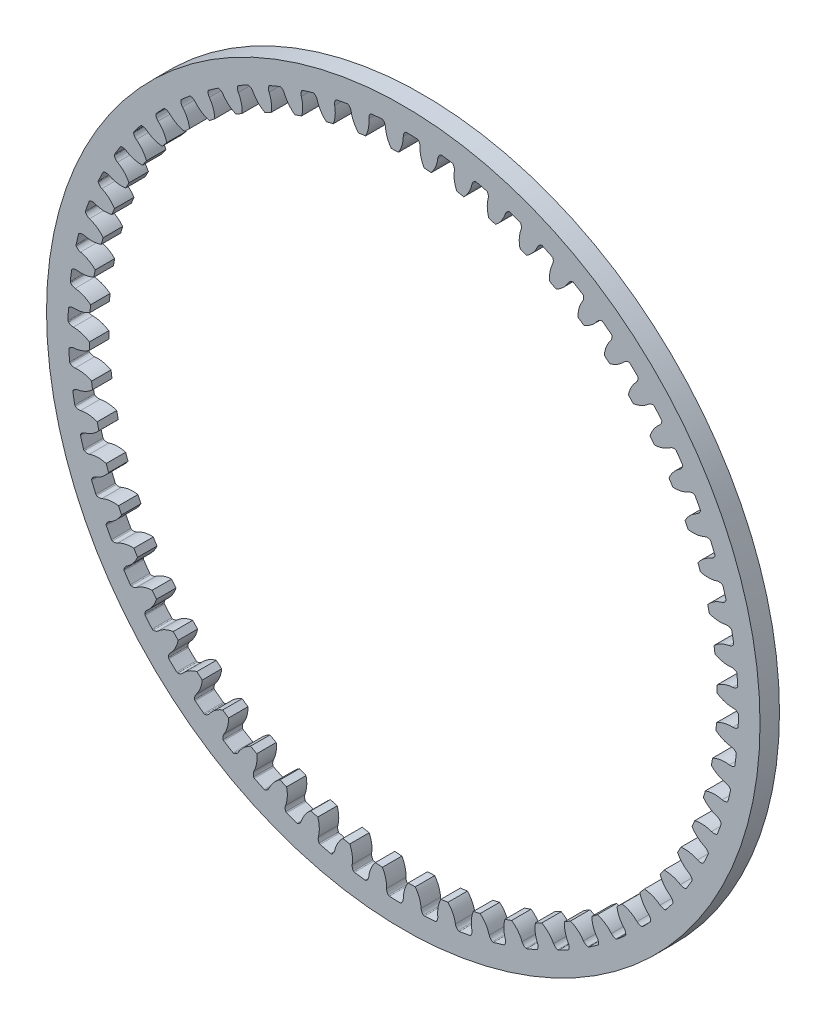
from build123d import *

# Parameters (mm, degrees)
BOSS_EXTRUDE1_DEPTH = 4
CHAMFER1_SIZE       = 0.5
FILLET2_R           = 1.4
FILLET3_R           = 0.3
CIRPATTERN1_DEPTH   = 4


# Read off the part's stored shape, not the designer's step: CirPattern1
with BuildPart() as part:
    # Sketch1 → Boss-Extrude1 (new body)
    with BuildSketch(Plane.XY):
        with BuildLine():
            Line((-7.093200614, 67.487306793), (-7.203054967, 68.532503961))
            ThreePointArc((-7.203054967, 68.532503961), (-5.465102965, 68.692945414), (-3.7236451, 68.809320351))
            Line((-3.7236451, 68.809320351), (-3.669087823, 67.801148418))
            ThreePointArc((-3.669087823, 67.801148418), (-3.311888955, 66.061957245), (-2.461340021, 64.503450435))
            Line((-2.461340021, 64.503450435), (-0.999634675, 64.542971937))
            ThreePointArc((-0.999634675, 64.542971937), (-0.255341962, 66.127311516), (0, 67.859045914))
            Line((0, 67.859045914), (0, 68.91))
            ThreePointArc((0, 68.91), (0.866615162, 68.90455049), (1.733093257, 68.88820282))
            Line((1.733093257, 68.88820282), (1.844759693, 73.326798387))
            ThreePointArc((1.844759693, 73.326798387), (-5.830083646, 73.117936409), (-13.441051368, 72.107979018))
            Line((-13.441051368, 72.107979018), (-12.627441714, 67.743160657))
            ThreePointArc((-12.627441714, 67.743160657), (-11.762567505, 67.898675287), (-10.895780524, 68.043148566))
            Line((-10.895780524, 68.043148566), (-10.736139102, 67.046202549))
            ThreePointArc((-10.736139102, 67.046202549), (-10.199101212, 65.353876174), (-9.190302449, 63.892813782))
            Line((-9.190302449, 63.892813782), (-7.740736018, 64.084908534))
            ThreePointArc((-7.740736018, 64.084908534), (-7.166128741, 65.738368542), (-7.093200614, 67.487306793))
        make_face()
    extrude(amount=BOSS_EXTRUDE1_DEPTH)

    # Chamfer1
    chamfer1_edges = [part.edges().sort_by_distance(p)[0] for p in [
        (-3.7236451, 68.809320351, 2),
        (-7.203054967, 68.532503961, 2),
        (-10.895780524, 68.043148566, 2),
        (0, 68.91, 2),
    ]]
    chamfer(chamfer1_edges, length=CHAMFER1_SIZE - 0.0004)  # a hair under: the kernel refuses the full size

    # Fillet2
    fillet2_edges = [part.edges().sort_by_distance(p)[0] for p in [
        (0, 68.4104, 2),
        (-3.696648719, 68.310450272, 2),
        (-7.150832686, 68.035640807, 2),
        (-10.81678572, 67.54983327, 2),
    ]]
    fillet(fillet2_edges, radius=FILLET2_R)

    # Fillet3
    fillet3_edges = [part.edges().sort_by_distance(p)[0] for p in [
        (-11.38880622, 67.962366004, 2),
        (0.499596717, 68.908188941, 2),
        (-4.222414028, 68.780515553, 2),
        (-6.706005784, 68.58292489, 2),
    ]]
    fillet(fillet3_edges, radius=FILLET3_R)

    # CirPattern1 outline → CirPattern1 (add)
    with BuildSketch(Plane.XY):
        with BuildLine():
            Line((1.844759693, 73.326798387), (1.733093257, 68.88820282))
            ThreePointArc((1.733093257, 68.88820282), (2.299511856, 68.871622205), (2.86577496, 68.850384413))
            ThreePointArc((2.86577496, 68.850384413), (2.980831386, 68.822186651), (3.076002513, 68.751649061))
            ThreePointArc((3.076002513, 68.751649061), (3.353485369, 68.289151249), (3.435535192, 67.756076407))
            ThreePointArc((3.435535192, 67.756076407), (3.618653485, 66.018512763), (4.294590654, 64.407373827))
            Line((4.294590654, 64.407373827), (5.752419325, 64.29388904))
            ThreePointArc((5.752419325, 64.29388904), (6.65368157, 65.780913241), (7.090699115, 67.463925503))
            ThreePointArc((7.090699115, 67.463925503), (7.25312204, 67.982028039), (7.600452429, 68.399368483))
            ThreePointArc((7.600452429, 68.399368483), (7.705424882, 68.454381137), (7.823510636, 68.464449033))
            ThreePointArc((7.823510636, 68.464449033), (8.936389306, 68.328098511), (10.046902252, 68.17365954))
            ThreePointArc((10.046902252, 68.17365954), (10.158380982, 68.133589535), (10.245657588, 68.05349018))
            ThreePointArc((10.245657588, 68.05349018), (10.4732759, 67.564521093), (10.499154515, 67.025790028))
            ThreePointArc((10.499154515, 67.025790028), (10.499644069, 65.278604195), (11.003467608, 63.605636647))
            Line((11.003467608, 63.605636647), (12.441448167, 63.34038888))
            ThreePointArc((12.441448167, 63.34038888), (13.493209118, 64.725059646), (14.103754874, 66.353171468))
            ThreePointArc((14.103754874, 66.353171468), (14.319444274, 66.851457878), (14.708495626, 67.230206223))
            ThreePointArc((14.708495626, 67.230206223), (14.818643464, 67.273944969), (14.937134782, 67.271614404))
            ThreePointArc((14.937134782, 67.271614404), (16.029664521, 67.019683343), (17.117950738, 66.750010206))
            ThreePointArc((17.117950738, 66.750010206), (17.224630261, 66.698507056), (17.30305608, 66.609723692))
            ThreePointArc((17.30305608, 66.609723692), (17.478316569, 66.099640638), (17.447740914, 65.561155642))
            ThreePointArc((17.447740914, 65.561155642), (17.265597838, 63.823489498), (17.591789537, 62.107022574))
            Line((17.591789537, 62.107022574), (18.994166341, 61.692918078))
            ThreePointArc((18.994166341, 61.692918078), (20.184903559, 62.960064275), (20.962289148, 64.515437624))
            ThreePointArc((20.962289148, 64.515437624), (21.228882316, 64.988448752), (21.65539266, 65.324455258))
            ThreePointArc((21.65539266, 65.324455258), (21.769508987, 65.356440753), (21.887107517, 65.341737232))
            ThreePointArc((21.887107517, 65.341737232), (22.947318251, 64.976985811), (24.001454157, 64.595033078))
            ThreePointArc((24.001454157, 64.595033078), (24.102165787, 64.532660967), (24.170881597, 64.436166149))
            ThreePointArc((24.170881597, 64.436166149), (24.291863513, 63.910557702), (24.205168131, 63.378218736))
            ThreePointArc((24.205168131, 63.378218736), (23.842386627, 61.669111322), (23.987370901, 59.927951325))
            Line((23.987370901, 59.927951325), (25.338780023, 59.369526888))
            ThreePointArc((25.338780023, 59.369526888), (26.655446714, 60.505265877), (27.591154063, 61.97085995))
            ThreePointArc((27.591154063, 61.97085995), (27.905729702, 62.413413258), (28.365025556, 62.702996719))
            ThreePointArc((28.365025556, 62.702996719), (28.481860196, 62.722878645), (28.597277643, 62.695963278))
            ThreePointArc((28.597277643, 62.695963278), (29.613553574, 62.22238781), (30.621989928, 61.732340251))
            ThreePointArc((30.621989928, 61.732340251), (30.71563014, 61.659782649), (30.773883068, 61.556633769))
            ThreePointArc((30.773883068, 61.556633769), (30.839261464, 61.021258549), (30.697396635, 60.500897778))
            ThreePointArc((30.697396635, 60.500897778), (30.157952716, 58.839073484), (30.120142804, 57.092296412))
            Line((30.120142804, 57.092296412), (31.405777144, 56.395670561))
            ThreePointArc((31.405777144, 56.395670561), (32.833948405, 57.387558385), (33.917726556, 58.747315543))
            ThreePointArc((33.917726556, 58.747315543), (34.276838568, 59.154562406), (34.763888318, 59.394549876))
            ThreePointArc((34.763888318, 59.394549876), (34.882161088, 59.402110294), (34.994132774, 59.36327797))
            ThreePointArc((34.994132774, 59.36327797), (35.955339275, 58.786067037), (36.907027344, 58.193293709))
            ThreePointArc((36.907027344, 58.193293709), (36.992570292, 58.111345453), (37.039722096, 58.002672457))
            ThreePointArc((37.039722096, 58.002672457), (37.048780125, 57.463396261), (36.853299751, 56.960715162))
            ThreePointArc((36.853299751, 56.960715162), (36.143102481, 55.364382361), (35.922910982, 53.631126963))
            Line((35.922910982, 53.631126963), (37.128685603, 52.803931684))
            ThreePointArc((37.128685603, 52.803931684), (38.652713382, 53.641101654), (39.872687422, 54.880124483))
            ThreePointArc((39.872687422, 54.880124483), (40.272400835, 55.247602986), (40.78186776, 55.435365376))
            ThreePointArc((40.78186776, 55.435365376), (40.900282967, 55.430521547), (41.007582247, 55.380197709))
            ThreePointArc((41.007582247, 55.380197709), (41.903188234, 54.705675353), (42.787701218, 54.016670802))
            ThreePointArc((42.787701218, 54.016670802), (42.864209593, 53.926229863), (42.899743696, 53.813223569))
            ThreePointArc((42.899743696, 53.813223569), (42.85238265, 53.275954649), (42.60542882, 52.796460366))
            ThreePointArc((42.60542882, 52.796460366), (41.732260347, 51.283107617), (41.332101297, 49.582362938))
            Line((41.332101297, 49.582362938), (42.444804783, 48.633661623))
            ThreePointArc((42.444804783, 48.633661623), (44.047992151, 49.306940817), (45.390796558, 50.411653871))
            ThreePointArc((45.390796558, 50.411653871), (45.826732496, 50.735337827), (46.353035241, 50.868817659))
            ThreePointArc((46.353035241, 50.868817659), (46.470295365, 50.851622571), (46.571746508, 50.790358605))
            ThreePointArc((46.571746508, 50.790358605), (47.391939439, 50.025915046), (48.199586335, 49.248228162))
            ThreePointArc((48.199586335, 49.248228162), (48.266221965, 49.150285293), (48.289749003, 49.034183652))
            ThreePointArc((48.289749003, 49.034183652), (48.186487266, 48.504808664), (47.890765331, 48.053755008))
            ThreePointArc((47.890765331, 48.053755008), (46.864191322, 46.639964225), (46.288447476, 44.990365002))
            Line((46.288447476, 44.990365002), (47.29588946, 43.930551285))
            ThreePointArc((47.29588946, 43.930551285), (48.960670999, 44.432563889), (50.41159301, 45.390864231))
            ThreePointArc((50.41159301, 45.390864231), (50.878974803, 45.667207356), (51.416346649, 45.744942558))
            ThreePointArc((51.416346649, 45.744942558), (51.531167112, 45.715584672), (51.62565873, 45.644051756))
            ThreePointArc((51.62565873, 45.644051756), (52.361452494, 44.798062377), (53.083384646, 43.940213638))
            ThreePointArc((53.083384646, 43.940213638), (53.139417401, 43.835842065), (53.150679669, 43.717917274))
            ThreePointArc((53.150679669, 43.717917274), (52.992649086, 43.202235884), (52.651399323, 42.78456429))
            ThreePointArc((52.651399323, 42.78456429), (51.482667946, 41.485823863), (50.73764863, 39.905442281))
            Line((50.73764863, 39.905442281), (51.628790781, 38.746128303))
            ThreePointArc((51.628790781, 38.746128303), (53.336927274, 39.071373335), (54.880070942, 39.872761023))
            ThreePointArc((54.880070942, 39.872761023), (55.373778312, 40.098735531), (55.916332097, 40.119874014))
            ThreePointArc((55.916332097, 40.119874014), (56.027454747, 40.078674929), (56.113951443, 39.997656849))
            ThreePointArc((56.113951443, 39.997656849), (56.757284438, 39.079390517), (57.385592117, 38.150778725))
            ThreePointArc((57.385592117, 38.150778725), (57.430408131, 38.041121817), (57.429282158, 37.922665729))
            ThreePointArc((57.429282158, 37.922665729), (57.21821369, 37.426328177), (56.835174659, 37.046615173))
            ThreePointArc((56.835174659, 37.046615173), (55.537090124, 35.877155848), (54.630956698, 34.383308203))
            Line((54.630956698, 34.383308203), (55.396035996, 33.137194992))
            ThreePointArc((55.396035996, 33.137194992), (57.128812354, 33.282109872), (58.747270082, 33.917805404))
            ThreePointArc((58.747270082, 33.917805404), (59.261893428, 34.090935629), (59.803684467, 34.055246241))
            ThreePointArc((59.803684467, 34.055246241), (59.909891979, 34.002657379), (59.987446199, 33.913041717))
            ThreePointArc((59.987446199, 33.913041717), (60.531270022, 32.932559111), (61.059069442, 31.94335829))
            ThreePointArc((61.059069442, 31.94335829), (61.092177677, 31.829617621), (61.078675895, 31.711928212))
            ThreePointArc((61.078675895, 31.711928212), (60.81688247, 31.240372104), (60.396251025, 30.902777452))
            ThreePointArc((60.396251025, 30.902777452), (58.983035915, 29.875410536), (57.925717252, 28.484462308))
            Line((57.925717252, 28.484462308), (58.556350879, 27.165203251))
            ThreePointArc((58.556350879, 27.165203251), (60.294782736, 27.128199352), (61.970822882, 27.591237187))
            ThreePointArc((61.970822882, 27.591237187), (62.500724303, 27.709626076), (63.035816924, 27.617499358))
            ThreePointArc((63.035816924, 27.617499358), (63.135945506, 27.554096874), (63.203707436, 27.456865559))
            ThreePointArc((63.203707436, 27.456865559), (63.642063756, 26.424909099), (64.063572157, 25.385957191))
            ThreePointArc((64.063572157, 25.385957191), (64.08460988, 25.269378776), (64.058880107, 25.15374534))
            ThreePointArc((64.058880107, 25.15374534), (63.749229611, 24.712137557), (63.29561413, 24.420360486))
            ThreePointArc((63.29561413, 24.420360486), (61.782751591, 23.546343603), (60.585830964, 22.273535846))
            Line((60.585830964, 22.273535846), (61.075109939, 20.895584268))
            ThreePointArc((61.075109939, 20.895584268), (62.800150473, 20.677067948), (64.51540955, 20.962375724))
            ThreePointArc((64.51540955, 20.962375724), (65.054782939, 21.024726429), (65.577314304, 20.877172249))
            ThreePointArc((65.577314304, 20.877172249), (65.670267088, 20.803650796), (65.727494418, 20.699869021))
            ThreePointArc((65.727494418, 20.699869021), (66.055580589, 19.627744982), (66.366179911, 18.550424903))
            ThreePointArc((66.366179911, 18.550424903), (66.374916636, 18.432286151), (66.337240896, 18.319975717))
            ThreePointArc((66.337240896, 18.319975717), (65.983126258, 17.913154155), (65.501496745, 17.670390951))
            ThreePointArc((65.501496745, 17.670390951), (63.905562183, 16.95929841), (62.582154071, 15.818574649))
            Line((62.582154071, 15.818574649), (62.92471746, 14.397028464))
            ThreePointArc((62.92471746, 14.397028464), (64.617466866, 13.999392883), (66.353152493, 14.103843889))
            ThreePointArc((66.353152493, 14.103843889), (66.896088731, 14.109472996), (67.400334072, 13.908107456))
            ThreePointArc((67.400334072, 13.908107456), (67.485092487, 13.825272566), (67.531158129, 13.716077491))
            ThreePointArc((67.531158129, 13.716077491), (67.745379499, 12.615532352), (67.941666682, 11.511647511))
            ThreePointArc((67.941666682, 11.511647511), (67.938006665, 11.393242626), (67.888797606, 11.285485579))
            ThreePointArc((67.888797606, 11.285485579), (67.494098296, 10.917907943), (66.989731537, 10.726818863))
            ThreePointArc((66.989731537, 10.726818863), (65.328210346, 10.186443155), (63.892813694, 9.190303092))
            Line((63.892813694, 9.190303092), (64.084908507, 7.740736243))
            ThreePointArc((64.084908507, 7.740736243), (65.726820669, 7.168338935), (67.463916042, 7.090789637))
            ThreePointArc((67.463916042, 7.090789637), (68.004466269, 7.039635796), (68.484900831, 6.786665649))
            ThreePointArc((68.484900831, 6.786665649), (68.560536403, 6.695424846), (68.594935735, 6.582012721))
            ThreePointArc((68.594935735, 6.582012721), (68.692945314, 5.465104214), (68.772769856, 4.346748933))
            ThreePointArc((68.772769856, 4.346748933), (68.756753236, 4.229375329), (68.696550149, 4.127352374))
            ThreePointArc((68.696550149, 4.127352374), (68.265590806, 3.803045412), (67.744012745, 3.665723573))
            ThreePointArc((67.744012745, 3.665723573), (66.03510873, 3.301983564), (64.503450455, 2.461339372))
            Line((64.503450455, 2.461339372), (64.542971941, 0.999634448))
            ThreePointArc((64.542971941, 0.999634448), (66.116057625, 0.258745767), (67.835530942, 4.4935e-05))
            ThreePointArc((67.835530942, 4.4935e-05), (68.367773077, -0.107331758), (68.819133198, -0.40913548))
            ThreePointArc((68.819133198, -0.40913548), (68.884817096, -0.507782494), (68.907173161, -0.62416898))
            ThreePointArc((68.907173161, -0.62416898), (68.88789708, -1.745203695), (68.850384353, -2.865776403))
            ThreePointArc((68.850384353, -2.865776403), (68.822186556, -2.980832897), (68.751648884, -3.076004056))
            ThreePointArc((68.751648884, -3.076004056), (68.289151013, -3.353486637), (67.756076224, -3.435536217))
            ThreePointArc((67.756076224, -3.435536217), (66.01851283, -3.618653739), (64.407373874, -4.294590007))
            Line((64.407373874, -4.294590007), (64.29388906, -5.752419099))
            ThreePointArc((64.29388906, -5.752419099), (65.78091341, -6.653680887), (67.463925676, -7.090697983))
            ThreePointArc((67.463925676, -7.090697983), (67.982028102, -7.253120701), (68.399368564, -7.600450806))
            ThreePointArc((68.399368564, -7.600450806), (68.454381288, -7.705423298), (68.464449206, -7.823509119))
            ThreePointArc((68.464449206, -7.823509119), (68.328098704, -8.936387833), (68.173659751, -10.046900823))
            ThreePointArc((68.173659751, -10.046900823), (68.133589788, -10.158379489), (68.053490518, -10.245656072))
            ThreePointArc((68.053490518, -10.245656072), (67.564521462, -10.473274664), (67.025790317, -10.499153514))
            ThreePointArc((67.025790317, -10.499153514), (65.278604154, -10.499643809), (63.605636532, -11.003468246))
            Line((63.605636532, -11.003468246), (63.340388836, -12.441448389))
            ThreePointArc((63.340388836, -12.441448389), (64.725059405, -13.49320978), (66.353171178, -14.103755982))
            ThreePointArc((66.353171178, -14.103755982), (66.851457676, -14.3194456), (67.230205973, -14.708497232))
            ThreePointArc((67.230205973, -14.708497232), (67.273944653, -14.818645022), (67.271614073, -14.937136272))
            ThreePointArc((67.271614073, -14.937136272), (67.019682997, -16.029665966), (66.750009847, -17.117952137))
            ThreePointArc((66.750009847, -17.117952137), (66.69850665, -17.22463172), (66.609723198, -17.303057553))
            ThreePointArc((66.609723198, -17.303057553), (66.099640142, -17.47831776), (65.56115525, -17.447741879))
            ThreePointArc((65.56115525, -17.447741879), (63.823489512, -17.265598101), (62.107022755, -17.591788915))
            Line((62.107022755, -17.591788915), (61.692918145, -18.994166124))
            ThreePointArc((61.692918145, -18.994166124), (62.960064583, -20.184902926), (64.515438029, -20.962288076))
            ThreePointArc((64.515438029, -20.962288076), (64.988449092, -21.22888102), (65.324455675, -21.655391089))
            ThreePointArc((65.324455675, -21.655391089), (65.356441231, -21.769507469), (65.341737717, -21.887106069))
            ThreePointArc((65.341737717, -21.887106069), (64.976986306, -22.94731685), (64.595033581, -24.001452803))
            ThreePointArc((64.595033581, -24.001452803), (64.532661524, -24.102164379), (64.436166794, -24.170880185))
            ThreePointArc((64.436166794, -24.170880185), (63.910558319, -24.29186238), (63.378219227, -24.205167213))
            ThreePointArc((63.378219227, -24.205167213), (61.669111336, -23.842386364), (59.927951079, -23.987371501))
            Line((59.927951079, -23.987371501), (59.369526799, -25.338780232))
            ThreePointArc((59.369526799, -25.338780232), (60.505265506, -26.655447312), (61.970859436, -27.591155086))
            ThreePointArc((61.970859436, -27.591155086), (62.413412785, -27.905730956), (62.702996141, -28.365027075))
            ThreePointArc((62.702996141, -28.365027075), (62.722878012, -28.481861655), (62.695962645, -28.597279032))
            ThreePointArc((62.695962645, -28.597279032), (62.222387171, -29.613554915), (61.732339609, -30.621991222))
            ThreePointArc((61.732339609, -30.621991222), (61.659781947, -30.715631482), (61.556632979, -30.773884405))
            ThreePointArc((61.556632979, -30.773884405), (61.021257816, -30.839262526), (60.500897194, -30.697397497))
            ThreePointArc((60.500897194, -30.697397497), (58.839073442, -30.157952975), (57.092296719, -30.120142232))
            Line((57.092296719, -30.120142232), (56.395670671, -31.405776945))
            ThreePointArc((56.395670671, -31.405776945), (57.387558817, -32.83394785), (58.747316161, -33.917725592))
            ThreePointArc((58.747316161, -33.917725592), (59.154563008, -34.27683737), (59.394550611, -34.763886868))
            ThreePointArc((59.394550611, -34.763886868), (59.402111076, -34.882159703), (59.363278746, -34.994131459))
            ThreePointArc((59.363278746, -34.994131459), (58.786067812, -35.955338007), (58.193294482, -36.907026124))
            ThreePointArc((58.193294482, -36.907026124), (58.11134629, -36.99256903), (58.002673382, -37.039720848))
            ThreePointArc((58.002673382, -37.039720848), (57.4633971, -37.048779146), (56.960715834, -36.853298955))
            ThreePointArc((56.960715834, -36.853298955), (55.36438243, -36.143102227), (53.631126598, -35.922911518))
            Line((53.631126598, -35.922911518), (52.803931554, -37.128685789))
            ThreePointArc((52.803931554, -37.128685789), (53.641101166, -38.652713889), (54.880123767, -39.872688316))
            ThreePointArc((54.880123767, -39.872688316), (55.247602263, -40.272401964), (55.435364495, -40.781869126))
            ThreePointArc((55.435364495, -40.781869126), (55.430520624, -40.900284263), (55.3801968, -41.007583474))
            ThreePointArc((55.3801968, -41.007583474), (54.70567445, -41.903189413), (54.016669905, -42.78770235))
            ThreePointArc((54.016669905, -42.78770235), (53.926228897, -42.86421076), (53.813222518, -42.89974484))
            ThreePointArc((53.813222518, -42.89974484), (53.275953711, -42.852383537), (52.796459615, -42.605429542))
            ThreePointArc((52.796459615, -42.605429542), (51.283107522, -41.732260592), (49.582363357, -41.332100802))
            Line((49.582363357, -41.332100802), (48.633661772, -42.444804612))
            ThreePointArc((48.633661772, -42.444804612), (49.306941355, -44.047991698), (50.411654676, -45.390795744))
            ThreePointArc((50.411654676, -45.390795744), (50.735338665, -45.826731449), (50.868818678, -46.353033975))
            ThreePointArc((50.868818678, -46.353033975), (50.851623624, -46.470294173), (50.790359637, -46.571745383))
            ThreePointArc((50.790359637, -46.571745383), (50.025916068, -47.391938361), (49.248229172, -48.199585303))
            ThreePointArc((49.248229172, -48.199585303), (49.150286375, -48.266220905), (49.034184816, -48.289747975))
            ThreePointArc((49.034184816, -48.289747975), (48.504809689, -48.186486483), (48.053755831, -47.890764691))
            ThreePointArc((48.053755831, -47.890764691), (46.639964345, -46.864191089), (44.990364534, -46.288447924))
            Line((44.990364534, -46.288447924), (43.930551119, -47.295889614))
            ThreePointArc((43.930551119, -47.295889614), (44.432563307, -48.960671393), (45.390863345, -50.411593735))
            ThreePointArc((45.390863345, -50.411593735), (45.667206414, -50.878975756), (45.744941412, -51.416347802))
            ThreePointArc((45.744941412, -51.416347802), (45.7155835, -51.531168187), (45.644050612, -51.625659741))
            ThreePointArc((45.644050612, -51.625659741), (44.798061248, -52.36145346), (43.940212525, -53.083385567))
            ThreePointArc((43.940212525, -53.083385567), (43.835840878, -53.139418341), (43.717916009, -53.15068057))
            ThreePointArc((43.717916009, -53.15068057), (43.202234783, -52.992649758), (42.784563406, -52.651399872))
            ThreePointArc((42.784563406, -52.651399872), (41.48582372, -51.482668166), (39.905442793, -50.737648233))
            Line((39.905442793, -50.737648233), (38.746128484, -51.628790645))
            ThreePointArc((38.746128484, -51.628790645), (39.071373955, -53.336926943), (39.87276198, -54.880070313))
            ThreePointArc((39.87276198, -54.880070313), (40.098736567, -55.373777462), (40.119875274, -55.916331071))
            ThreePointArc((40.119875274, -55.916331071), (40.078676207, -56.0274538), (39.997658092, -56.113950557))
            ThreePointArc((39.997658092, -56.113950557), (39.079391741, -56.757283596), (38.150779928, -57.385591318))
            ThreePointArc((38.150779928, -57.385591318), (38.041123095, -57.430407319), (37.922667081, -57.429281394))
            ThreePointArc((37.922667081, -57.429281394), (37.426329342, -57.218213136), (37.046616111, -56.835174205))
            ThreePointArc((37.046616111, -56.835174205), (35.877156014, -55.53708992), (34.383307651, -54.63095704))
            Line((34.383307651, -54.63095704), (33.137194797, -55.396036112))
            ThreePointArc((33.137194797, -55.396036112), (33.28210922, -57.128812618), (33.917804386, -58.747270607))
            ThreePointArc((33.917804386, -58.747270607), (34.09093451, -59.261894164), (34.05524488, -59.803685356))
            ThreePointArc((34.05524488, -59.803685356), (34.002656009, -59.909892788), (33.913040387, -59.987446951))
            ThreePointArc((33.913040387, -59.987446951), (32.932557805, -60.531270732), (31.94335701, -61.059070112))
            ThreePointArc((31.94335701, -61.059070112), (31.829616265, -61.09217835), (31.711926788, -61.078676513))
            ThreePointArc((31.711926788, -61.078676513), (31.240370887, -60.816882898), (30.902776472, -60.396251379))
            ThreePointArc((30.902776472, -60.396251379), (29.875410349, -58.9830361), (28.484462892, -57.92571697))
            Line((28.484462892, -57.92571697), (27.165203457, -58.556350784))
            ThreePointArc((27.165203457, -58.556350784), (27.128200028, -60.294782541), (27.591238254, -61.970822466))
            ThreePointArc((27.591238254, -61.970822466), (27.709627267, -62.500723687), (27.617500804, -63.035816182))
            ThreePointArc((27.617500804, -63.035816182), (27.554098321, -63.135944845), (27.456866959, -63.203706828))
            ThreePointArc((27.456866959, -63.203706828), (26.42491047, -63.642063186), (25.385958533, -64.063571625))
            ThreePointArc((25.385958533, -64.063571625), (25.269380195, -64.084609352), (25.153746822, -64.058879641))
            ThreePointArc((25.153746822, -64.058879641), (24.712138811, -63.749229312), (24.420361497, -63.295613881))
            ThreePointArc((24.420361497, -63.295613881), (23.546343808, -61.782751426), (22.273535235, -60.585831184))
            Line((22.273535235, -60.585831184), (20.895584053, -61.075110013))
            ThreePointArc((20.895584053, -61.075110013), (20.677067255, -62.800150597), (20.96237462, -64.515409853))
            ThreePointArc((20.96237462, -64.515409853), (21.02472518, -65.054783427), (20.877170733, -65.57731489))
            ThreePointArc((20.877170733, -65.57731489), (20.803649288, -65.670267593), (20.699867565, -65.727494877))
            ThreePointArc((20.699867565, -65.727494877), (19.627743558, -66.055581012), (18.550423512, -66.366180299))
            ThreePointArc((18.550423512, -66.366180299), (18.432284685, -66.374917013), (18.319974195, -66.337241205))
            ThreePointArc((18.319974195, -66.337241205), (17.913152876, -65.983126424), (17.670389919, -65.501496887))
            ThreePointArc((17.670389919, -65.501496887), (16.959298189, -63.905562326), (15.818575279, -62.582153917))
            Line((15.818575279, -62.582153917), (14.397028685, -62.924717409))
            ThreePointArc((14.397028685, -62.924717409), (13.999393584, -64.617466816), (14.103845019, -66.353152307))
            ThreePointArc((14.103845019, -66.353152307), (14.109474289, -66.896088376), (13.908109025, -67.400333647))
            ThreePointArc((13.908109025, -67.400333647), (13.825274119, -67.485092141), (13.716078987, -67.531157825))
            ThreePointArc((13.716078987, -67.531157825), (12.615533812, -67.745379227), (11.511648935, -67.941666441))
            ThreePointArc((11.511648935, -67.941666441), (11.393244124, -67.938006444), (11.285487125, -67.888797459))
            ThreePointArc((11.285487125, -67.888797459), (10.917909233, -67.494098264), (10.726819904, -66.989731503))
            ThreePointArc((10.726819904, -66.989731503), (10.186443389, -65.328210227), (9.190302449, -63.892813782))
            Line((9.190302449, -63.892813782), (7.740736018, -64.084908534))
            ThreePointArc((7.740736018, -64.084908534), (7.168338232, -65.726820646), (7.090788493, -67.463916109))
            ThreePointArc((7.090788493, -67.463916109), (7.039634473, -68.004466487), (6.786664044, -68.484901089))
            ThreePointArc((6.786664044, -68.484901089), (6.695423265, -68.560536585), (6.582011201, -68.594935881))
            ThreePointArc((6.582011201, -68.594935881), (5.465102733, -68.692945432), (4.346747492, -68.772769947))
            ThreePointArc((4.346747492, -68.772769947), (4.229373817, -68.756753299), (4.127350821, -68.696550134))
            ThreePointArc((4.127350821, -68.696550134), (3.803044127, -68.265590702), (3.665722535, -67.74401267))
            ThreePointArc((3.665722535, -67.74401267), (3.301983318, -66.035108824), (2.461340021, -64.503450435))
            Line((2.461340021, -64.503450435), (0.999634675, -64.542971937))
            ThreePointArc((0.999634675, -64.542971937), (0.258746464, -66.116057722), (4.6079e-05, -67.835530996))
            ThreePointArc((4.6079e-05, -67.835530996), (-0.10733042, -68.367773), (-0.409133857, -68.819133109))
            ThreePointArc((-0.409133857, -68.819133109), (-0.507780904, -68.884817081), (-0.624167454, -68.907173175))
            ThreePointArc((-0.624167454, -68.907173175), (-1.74520221, -68.887897117), (-2.86577496, -68.850384413))
            ThreePointArc((-2.86577496, -68.850384413), (-2.980831386, -68.822186651), (-3.076002513, -68.751649061))
            ThreePointArc((-3.076002513, -68.751649061), (-3.353485369, -68.289151249), (-3.435535192, -67.756076407))
            ThreePointArc((-3.435535192, -67.756076407), (-3.618653485, -66.018512763), (-4.294590654, -64.407373827))
            Line((-4.294590654, -64.407373827), (-5.752419325, -64.29388904))
            ThreePointArc((-5.752419325, -64.29388904), (-6.65368157, -65.780913241), (-7.090699115, -67.463925503))
            ThreePointArc((-7.090699115, -67.463925503), (-7.25312204, -67.982028039), (-7.600452429, -68.399368483))
            ThreePointArc((-7.600452429, -68.399368483), (-7.705424882, -68.454381137), (-7.823510636, -68.464449033))
            ThreePointArc((-7.823510636, -68.464449033), (-8.936389306, -68.328098511), (-10.046902252, -68.17365954))
            ThreePointArc((-10.046902252, -68.17365954), (-10.158380982, -68.133589535), (-10.245657588, -68.05349018))
            ThreePointArc((-10.245657588, -68.05349018), (-10.4732759, -67.564521093), (-10.499154515, -67.025790028))
            ThreePointArc((-10.499154515, -67.025790028), (-10.499644069, -65.278604195), (-11.003467608, -63.605636647))
            Line((-11.003467608, -63.605636647), (-12.441448167, -63.34038888))
            ThreePointArc((-12.441448167, -63.34038888), (-13.493209118, -64.725059646), (-14.103754874, -66.353171468))
            ThreePointArc((-14.103754874, -66.353171468), (-14.319444274, -66.851457878), (-14.708495626, -67.230206223))
            ThreePointArc((-14.708495626, -67.230206223), (-14.818643464, -67.273944969), (-14.937134782, -67.271614404))
            ThreePointArc((-14.937134782, -67.271614404), (-16.029664521, -67.019683343), (-17.117950738, -66.750010206))
            ThreePointArc((-17.117950738, -66.750010206), (-17.224630261, -66.698507056), (-17.30305608, -66.609723692))
            ThreePointArc((-17.30305608, -66.609723692), (-17.478316569, -66.099640638), (-17.447740914, -65.561155642))
            ThreePointArc((-17.447740914, -65.561155642), (-17.265597838, -63.823489498), (-17.591789537, -62.107022574))
            Line((-17.591789537, -62.107022574), (-18.994166341, -61.692918078))
            ThreePointArc((-18.994166341, -61.692918078), (-20.184903559, -62.960064275), (-20.962289148, -64.515437624))
            ThreePointArc((-20.962289148, -64.515437624), (-21.228882316, -64.988448752), (-21.65539266, -65.324455258))
            ThreePointArc((-21.65539266, -65.324455258), (-21.769508987, -65.356440753), (-21.887107517, -65.341737232))
            ThreePointArc((-21.887107517, -65.341737232), (-22.947318251, -64.976985811), (-24.001454157, -64.595033078))
            ThreePointArc((-24.001454157, -64.595033078), (-24.102165787, -64.532660967), (-24.170881597, -64.436166149))
            ThreePointArc((-24.170881597, -64.436166149), (-24.291863513, -63.910557702), (-24.205168131, -63.378218736))
            ThreePointArc((-24.205168131, -63.378218736), (-23.842386627, -61.669111322), (-23.987370901, -59.927951325))
            Line((-23.987370901, -59.927951325), (-25.338780023, -59.369526888))
            ThreePointArc((-25.338780023, -59.369526888), (-26.655446714, -60.505265877), (-27.591154063, -61.97085995))
            ThreePointArc((-27.591154063, -61.97085995), (-27.905729702, -62.413413258), (-28.365025556, -62.702996719))
            ThreePointArc((-28.365025556, -62.702996719), (-28.481860196, -62.722878645), (-28.597277643, -62.695963278))
            ThreePointArc((-28.597277643, -62.695963278), (-29.613553574, -62.22238781), (-30.621989928, -61.732340251))
            ThreePointArc((-30.621989928, -61.732340251), (-30.71563014, -61.659782649), (-30.773883068, -61.556633769))
            ThreePointArc((-30.773883068, -61.556633769), (-30.839261464, -61.021258549), (-30.697396635, -60.500897778))
            ThreePointArc((-30.697396635, -60.500897778), (-30.157952716, -58.839073484), (-30.120142804, -57.092296412))
            Line((-30.120142804, -57.092296412), (-31.405777144, -56.395670561))
            ThreePointArc((-31.405777144, -56.395670561), (-32.833948405, -57.387558385), (-33.917726556, -58.747315543))
            ThreePointArc((-33.917726556, -58.747315543), (-34.276838568, -59.154562406), (-34.763888318, -59.394549876))
            ThreePointArc((-34.763888318, -59.394549876), (-34.882161088, -59.402110294), (-34.994132774, -59.36327797))
            ThreePointArc((-34.994132774, -59.36327797), (-35.955339275, -58.786067037), (-36.907027344, -58.193293709))
            ThreePointArc((-36.907027344, -58.193293709), (-36.992570292, -58.111345453), (-37.039722096, -58.002672457))
            ThreePointArc((-37.039722096, -58.002672457), (-37.048780125, -57.463396261), (-36.853299751, -56.960715162))
            ThreePointArc((-36.853299751, -56.960715162), (-36.143102481, -55.364382361), (-35.922910982, -53.631126963))
            Line((-35.922910982, -53.631126963), (-37.128685603, -52.803931684))
            ThreePointArc((-37.128685603, -52.803931684), (-38.652713382, -53.641101654), (-39.872687422, -54.880124483))
            ThreePointArc((-39.872687422, -54.880124483), (-40.272400835, -55.247602986), (-40.78186776, -55.435365376))
            ThreePointArc((-40.78186776, -55.435365376), (-40.900282967, -55.430521547), (-41.007582247, -55.380197709))
            ThreePointArc((-41.007582247, -55.380197709), (-41.903188234, -54.705675353), (-42.787701218, -54.016670802))
            ThreePointArc((-42.787701218, -54.016670802), (-42.864209593, -53.926229863), (-42.899743696, -53.813223569))
            ThreePointArc((-42.899743696, -53.813223569), (-42.85238265, -53.275954649), (-42.60542882, -52.796460366))
            ThreePointArc((-42.60542882, -52.796460366), (-41.732260347, -51.283107617), (-41.332101297, -49.582362938))
            Line((-41.332101297, -49.582362938), (-42.444804783, -48.633661623))
            ThreePointArc((-42.444804783, -48.633661623), (-44.047992151, -49.306940817), (-45.390796558, -50.411653871))
            ThreePointArc((-45.390796558, -50.411653871), (-45.826732496, -50.735337827), (-46.353035241, -50.868817659))
            ThreePointArc((-46.353035241, -50.868817659), (-46.470295365, -50.851622571), (-46.571746508, -50.790358605))
            ThreePointArc((-46.571746508, -50.790358605), (-47.391939439, -50.025915046), (-48.199586335, -49.248228162))
            ThreePointArc((-48.199586335, -49.248228162), (-48.266221965, -49.150285293), (-48.289749003, -49.034183652))
            ThreePointArc((-48.289749003, -49.034183652), (-48.186487266, -48.504808664), (-47.890765331, -48.053755008))
            ThreePointArc((-47.890765331, -48.053755008), (-46.864191322, -46.639964225), (-46.288447476, -44.990365002))
            Line((-46.288447476, -44.990365002), (-47.29588946, -43.930551285))
            ThreePointArc((-47.29588946, -43.930551285), (-48.960670999, -44.432563889), (-50.41159301, -45.390864231))
            ThreePointArc((-50.41159301, -45.390864231), (-50.878974803, -45.667207356), (-51.416346649, -45.744942558))
            ThreePointArc((-51.416346649, -45.744942558), (-51.531167112, -45.715584672), (-51.62565873, -45.644051756))
            ThreePointArc((-51.62565873, -45.644051756), (-52.361452494, -44.798062377), (-53.083384646, -43.940213638))
            ThreePointArc((-53.083384646, -43.940213638), (-53.139417401, -43.835842065), (-53.150679669, -43.717917274))
            ThreePointArc((-53.150679669, -43.717917274), (-52.992649086, -43.202235884), (-52.651399323, -42.78456429))
            ThreePointArc((-52.651399323, -42.78456429), (-51.482667946, -41.485823863), (-50.73764863, -39.905442281))
            Line((-50.73764863, -39.905442281), (-51.628790781, -38.746128303))
            ThreePointArc((-51.628790781, -38.746128303), (-53.336927274, -39.071373335), (-54.880070942, -39.872761023))
            ThreePointArc((-54.880070942, -39.872761023), (-55.373778312, -40.098735531), (-55.916332097, -40.119874014))
            ThreePointArc((-55.916332097, -40.119874014), (-56.027454747, -40.078674929), (-56.113951443, -39.997656849))
            ThreePointArc((-56.113951443, -39.997656849), (-56.757284438, -39.079390517), (-57.385592117, -38.150778725))
            ThreePointArc((-57.385592117, -38.150778725), (-57.430408131, -38.041121817), (-57.429282158, -37.922665729))
            ThreePointArc((-57.429282158, -37.922665729), (-57.21821369, -37.426328177), (-56.835174659, -37.046615173))
            ThreePointArc((-56.835174659, -37.046615173), (-55.537090124, -35.877155848), (-54.630956698, -34.383308203))
            Line((-54.630956698, -34.383308203), (-55.396035996, -33.137194992))
            ThreePointArc((-55.396035996, -33.137194992), (-57.128812354, -33.282109872), (-58.747270082, -33.917805404))
            ThreePointArc((-58.747270082, -33.917805404), (-59.261893428, -34.090935629), (-59.803684467, -34.055246241))
            ThreePointArc((-59.803684467, -34.055246241), (-59.909891979, -34.002657379), (-59.987446199, -33.913041717))
            ThreePointArc((-59.987446199, -33.913041717), (-60.531270022, -32.932559111), (-61.059069442, -31.94335829))
            ThreePointArc((-61.059069442, -31.94335829), (-61.092177677, -31.829617621), (-61.078675895, -31.711928212))
            ThreePointArc((-61.078675895, -31.711928212), (-60.81688247, -31.240372104), (-60.396251025, -30.902777452))
            ThreePointArc((-60.396251025, -30.902777452), (-58.983035915, -29.875410536), (-57.925717252, -28.484462308))
            Line((-57.925717252, -28.484462308), (-58.556350879, -27.165203251))
            ThreePointArc((-58.556350879, -27.165203251), (-60.294782736, -27.128199352), (-61.970822882, -27.591237187))
            ThreePointArc((-61.970822882, -27.591237187), (-62.500724303, -27.709626076), (-63.035816924, -27.617499358))
            ThreePointArc((-63.035816924, -27.617499358), (-63.135945506, -27.554096874), (-63.203707436, -27.456865559))
            ThreePointArc((-63.203707436, -27.456865559), (-63.642063756, -26.424909099), (-64.063572157, -25.385957191))
            ThreePointArc((-64.063572157, -25.385957191), (-64.08460988, -25.269378776), (-64.058880107, -25.15374534))
            ThreePointArc((-64.058880107, -25.15374534), (-63.749229611, -24.712137557), (-63.29561413, -24.420360486))
            ThreePointArc((-63.29561413, -24.420360486), (-61.782751591, -23.546343603), (-60.585830964, -22.273535846))
            Line((-60.585830964, -22.273535846), (-61.075109939, -20.895584268))
            ThreePointArc((-61.075109939, -20.895584268), (-62.800150473, -20.677067948), (-64.51540955, -20.962375724))
            ThreePointArc((-64.51540955, -20.962375724), (-65.054782939, -21.024726429), (-65.577314304, -20.877172249))
            ThreePointArc((-65.577314304, -20.877172249), (-65.670267088, -20.803650796), (-65.727494418, -20.699869021))
            ThreePointArc((-65.727494418, -20.699869021), (-66.055580589, -19.627744982), (-66.366179911, -18.550424903))
            ThreePointArc((-66.366179911, -18.550424903), (-66.374916636, -18.432286151), (-66.337240896, -18.319975717))
            ThreePointArc((-66.337240896, -18.319975717), (-65.983126258, -17.913154155), (-65.501496745, -17.670390951))
            ThreePointArc((-65.501496745, -17.670390951), (-63.905562183, -16.95929841), (-62.582154071, -15.818574649))
            Line((-62.582154071, -15.818574649), (-62.92471746, -14.397028464))
            ThreePointArc((-62.92471746, -14.397028464), (-64.617466866, -13.999392883), (-66.353152493, -14.103843889))
            ThreePointArc((-66.353152493, -14.103843889), (-66.896088731, -14.109472996), (-67.400334072, -13.908107456))
            ThreePointArc((-67.400334072, -13.908107456), (-67.485092487, -13.825272566), (-67.531158129, -13.716077491))
            ThreePointArc((-67.531158129, -13.716077491), (-67.745379499, -12.615532352), (-67.941666682, -11.511647511))
            ThreePointArc((-67.941666682, -11.511647511), (-67.938006665, -11.393242626), (-67.888797606, -11.285485579))
            ThreePointArc((-67.888797606, -11.285485579), (-67.494098296, -10.917907943), (-66.989731537, -10.726818863))
            ThreePointArc((-66.989731537, -10.726818863), (-65.328210346, -10.186443155), (-63.892813694, -9.190303092))
            Line((-63.892813694, -9.190303092), (-64.084908507, -7.740736243))
            ThreePointArc((-64.084908507, -7.740736243), (-65.726820669, -7.168338935), (-67.463916042, -7.090789637))
            ThreePointArc((-67.463916042, -7.090789637), (-68.004466269, -7.039635796), (-68.484900831, -6.786665649))
            ThreePointArc((-68.484900831, -6.786665649), (-68.560536403, -6.695424846), (-68.594935735, -6.582012721))
            ThreePointArc((-68.594935735, -6.582012721), (-68.692945314, -5.465104214), (-68.772769856, -4.346748933))
            ThreePointArc((-68.772769856, -4.346748933), (-68.756753236, -4.229375329), (-68.696550149, -4.127352374))
            ThreePointArc((-68.696550149, -4.127352374), (-68.265590806, -3.803045412), (-67.744012745, -3.665723573))
            ThreePointArc((-67.744012745, -3.665723573), (-66.03510873, -3.301983564), (-64.503450455, -2.461339372))
            Line((-64.503450455, -2.461339372), (-64.542971941, -0.999634448))
            ThreePointArc((-64.542971941, -0.999634448), (-66.116057625, -0.258745767), (-67.835530942, -4.4935e-05))
            ThreePointArc((-67.835530942, -4.4935e-05), (-68.367773077, 0.107331758), (-68.819133198, 0.40913548))
            ThreePointArc((-68.819133198, 0.40913548), (-68.884817096, 0.507782494), (-68.907173161, 0.62416898))
            ThreePointArc((-68.907173161, 0.62416898), (-68.88789708, 1.745203695), (-68.850384353, 2.865776403))
            ThreePointArc((-68.850384353, 2.865776403), (-68.822186556, 2.980832897), (-68.751648884, 3.076004056))
            ThreePointArc((-68.751648884, 3.076004056), (-68.289151013, 3.353486637), (-67.756076224, 3.435536217))
            ThreePointArc((-67.756076224, 3.435536217), (-66.01851283, 3.618653739), (-64.407373874, 4.294590007))
            Line((-64.407373874, 4.294590007), (-64.29388906, 5.752419099))
            ThreePointArc((-64.29388906, 5.752419099), (-65.78091341, 6.653680887), (-67.463925676, 7.090697983))
            ThreePointArc((-67.463925676, 7.090697983), (-67.982028102, 7.253120701), (-68.399368564, 7.600450806))
            ThreePointArc((-68.399368564, 7.600450806), (-68.454381288, 7.705423298), (-68.464449206, 7.823509119))
            ThreePointArc((-68.464449206, 7.823509119), (-68.328098704, 8.936387833), (-68.173659751, 10.046900823))
            ThreePointArc((-68.173659751, 10.046900823), (-68.133589788, 10.158379489), (-68.053490518, 10.245656072))
            ThreePointArc((-68.053490518, 10.245656072), (-67.564521462, 10.473274664), (-67.025790317, 10.499153514))
            ThreePointArc((-67.025790317, 10.499153514), (-65.278604154, 10.499643809), (-63.605636532, 11.003468246))
            Line((-63.605636532, 11.003468246), (-63.340388836, 12.441448389))
            ThreePointArc((-63.340388836, 12.441448389), (-64.725059405, 13.49320978), (-66.353171178, 14.103755982))
            ThreePointArc((-66.353171178, 14.103755982), (-66.851457676, 14.3194456), (-67.230205973, 14.708497232))
            ThreePointArc((-67.230205973, 14.708497232), (-67.273944653, 14.818645022), (-67.271614073, 14.937136272))
            ThreePointArc((-67.271614073, 14.937136272), (-67.019682997, 16.029665966), (-66.750009847, 17.117952137))
            ThreePointArc((-66.750009847, 17.117952137), (-66.69850665, 17.22463172), (-66.609723198, 17.303057553))
            ThreePointArc((-66.609723198, 17.303057553), (-66.099640142, 17.47831776), (-65.56115525, 17.447741879))
            ThreePointArc((-65.56115525, 17.447741879), (-63.823489512, 17.265598101), (-62.107022755, 17.591788915))
            Line((-62.107022755, 17.591788915), (-61.692918145, 18.994166124))
            ThreePointArc((-61.692918145, 18.994166124), (-62.960064583, 20.184902926), (-64.515438029, 20.962288076))
            ThreePointArc((-64.515438029, 20.962288076), (-64.988449092, 21.22888102), (-65.324455675, 21.655391089))
            ThreePointArc((-65.324455675, 21.655391089), (-65.356441231, 21.769507469), (-65.341737717, 21.887106069))
            ThreePointArc((-65.341737717, 21.887106069), (-64.976986306, 22.94731685), (-64.595033581, 24.001452803))
            ThreePointArc((-64.595033581, 24.001452803), (-64.532661524, 24.102164379), (-64.436166794, 24.170880185))
            ThreePointArc((-64.436166794, 24.170880185), (-63.910558319, 24.29186238), (-63.378219227, 24.205167213))
            ThreePointArc((-63.378219227, 24.205167213), (-61.669111336, 23.842386364), (-59.927951079, 23.987371501))
            Line((-59.927951079, 23.987371501), (-59.369526799, 25.338780232))
            ThreePointArc((-59.369526799, 25.338780232), (-60.505265506, 26.655447312), (-61.970859436, 27.591155086))
            ThreePointArc((-61.970859436, 27.591155086), (-62.413412785, 27.905730956), (-62.702996141, 28.365027075))
            ThreePointArc((-62.702996141, 28.365027075), (-62.722878012, 28.481861655), (-62.695962645, 28.597279032))
            ThreePointArc((-62.695962645, 28.597279032), (-62.222387171, 29.613554915), (-61.732339609, 30.621991222))
            ThreePointArc((-61.732339609, 30.621991222), (-61.659781947, 30.715631482), (-61.556632979, 30.773884405))
            ThreePointArc((-61.556632979, 30.773884405), (-61.021257816, 30.839262526), (-60.500897194, 30.697397497))
            ThreePointArc((-60.500897194, 30.697397497), (-58.839073442, 30.157952975), (-57.092296719, 30.120142232))
            Line((-57.092296719, 30.120142232), (-56.395670671, 31.405776945))
            ThreePointArc((-56.395670671, 31.405776945), (-57.387558817, 32.83394785), (-58.747316161, 33.917725592))
            ThreePointArc((-58.747316161, 33.917725592), (-59.154563008, 34.27683737), (-59.394550611, 34.763886868))
            ThreePointArc((-59.394550611, 34.763886868), (-59.402111076, 34.882159703), (-59.363278746, 34.994131459))
            ThreePointArc((-59.363278746, 34.994131459), (-58.786067812, 35.955338007), (-58.193294482, 36.907026124))
            ThreePointArc((-58.193294482, 36.907026124), (-58.11134629, 36.99256903), (-58.002673382, 37.039720848))
            ThreePointArc((-58.002673382, 37.039720848), (-57.4633971, 37.048779146), (-56.960715834, 36.853298955))
            ThreePointArc((-56.960715834, 36.853298955), (-55.36438243, 36.143102227), (-53.631126598, 35.922911518))
            Line((-53.631126598, 35.922911518), (-52.803931554, 37.128685789))
            ThreePointArc((-52.803931554, 37.128685789), (-53.641101166, 38.652713889), (-54.880123767, 39.872688316))
            ThreePointArc((-54.880123767, 39.872688316), (-55.247602263, 40.272401964), (-55.435364495, 40.781869126))
            ThreePointArc((-55.435364495, 40.781869126), (-55.430520624, 40.900284263), (-55.3801968, 41.007583474))
            ThreePointArc((-55.3801968, 41.007583474), (-54.70567445, 41.903189413), (-54.016669905, 42.78770235))
            ThreePointArc((-54.016669905, 42.78770235), (-53.926228897, 42.86421076), (-53.813222518, 42.89974484))
            ThreePointArc((-53.813222518, 42.89974484), (-53.275953711, 42.852383537), (-52.796459615, 42.605429542))
            ThreePointArc((-52.796459615, 42.605429542), (-51.283107522, 41.732260592), (-49.582363357, 41.332100802))
            Line((-49.582363357, 41.332100802), (-48.633661772, 42.444804612))
            ThreePointArc((-48.633661772, 42.444804612), (-49.306941355, 44.047991698), (-50.411654676, 45.390795744))
            ThreePointArc((-50.411654676, 45.390795744), (-50.735338665, 45.826731449), (-50.868818678, 46.353033975))
            ThreePointArc((-50.868818678, 46.353033975), (-50.851623624, 46.470294173), (-50.790359637, 46.571745383))
            ThreePointArc((-50.790359637, 46.571745383), (-50.025916068, 47.391938361), (-49.248229172, 48.199585303))
            ThreePointArc((-49.248229172, 48.199585303), (-49.150286375, 48.266220905), (-49.034184816, 48.289747975))
            ThreePointArc((-49.034184816, 48.289747975), (-48.504809689, 48.186486483), (-48.053755831, 47.890764691))
            ThreePointArc((-48.053755831, 47.890764691), (-46.639964345, 46.864191089), (-44.990364534, 46.288447924))
            Line((-44.990364534, 46.288447924), (-43.930551119, 47.295889614))
            ThreePointArc((-43.930551119, 47.295889614), (-44.432563307, 48.960671393), (-45.390863345, 50.411593735))
            ThreePointArc((-45.390863345, 50.411593735), (-45.667206414, 50.878975756), (-45.744941412, 51.416347802))
            ThreePointArc((-45.744941412, 51.416347802), (-45.7155835, 51.531168187), (-45.644050612, 51.625659741))
            ThreePointArc((-45.644050612, 51.625659741), (-44.798061248, 52.36145346), (-43.940212525, 53.083385567))
            ThreePointArc((-43.940212525, 53.083385567), (-43.835840878, 53.139418341), (-43.717916009, 53.15068057))
            ThreePointArc((-43.717916009, 53.15068057), (-43.202234783, 52.992649758), (-42.784563406, 52.651399872))
            ThreePointArc((-42.784563406, 52.651399872), (-41.48582372, 51.482668166), (-39.905442793, 50.737648233))
            Line((-39.905442793, 50.737648233), (-38.746128484, 51.628790645))
            ThreePointArc((-38.746128484, 51.628790645), (-39.071373955, 53.336926943), (-39.87276198, 54.880070313))
            ThreePointArc((-39.87276198, 54.880070313), (-40.098736567, 55.373777462), (-40.119875274, 55.916331071))
            ThreePointArc((-40.119875274, 55.916331071), (-40.078676207, 56.0274538), (-39.997658092, 56.113950557))
            ThreePointArc((-39.997658092, 56.113950557), (-39.079391741, 56.757283596), (-38.150779928, 57.385591318))
            ThreePointArc((-38.150779928, 57.385591318), (-38.041123095, 57.430407319), (-37.922667081, 57.429281394))
            ThreePointArc((-37.922667081, 57.429281394), (-37.426329342, 57.218213136), (-37.046616111, 56.835174205))
            ThreePointArc((-37.046616111, 56.835174205), (-35.877156014, 55.53708992), (-34.383307651, 54.63095704))
            Line((-34.383307651, 54.63095704), (-33.137194797, 55.396036112))
            ThreePointArc((-33.137194797, 55.396036112), (-33.28210922, 57.128812618), (-33.917804386, 58.747270607))
            ThreePointArc((-33.917804386, 58.747270607), (-34.09093451, 59.261894164), (-34.05524488, 59.803685356))
            ThreePointArc((-34.05524488, 59.803685356), (-34.002656009, 59.909892788), (-33.913040387, 59.987446951))
            ThreePointArc((-33.913040387, 59.987446951), (-32.932557805, 60.531270732), (-31.94335701, 61.059070112))
            ThreePointArc((-31.94335701, 61.059070112), (-31.829616265, 61.09217835), (-31.711926788, 61.078676513))
            ThreePointArc((-31.711926788, 61.078676513), (-31.240370887, 60.816882898), (-30.902776472, 60.396251379))
            ThreePointArc((-30.902776472, 60.396251379), (-29.875410349, 58.9830361), (-28.484462892, 57.92571697))
            Line((-28.484462892, 57.92571697), (-27.165203457, 58.556350784))
            ThreePointArc((-27.165203457, 58.556350784), (-27.128200028, 60.294782541), (-27.591238254, 61.970822466))
            ThreePointArc((-27.591238254, 61.970822466), (-27.709627267, 62.500723687), (-27.617500804, 63.035816182))
            ThreePointArc((-27.617500804, 63.035816182), (-27.554098321, 63.135944845), (-27.456866959, 63.203706828))
            ThreePointArc((-27.456866959, 63.203706828), (-26.42491047, 63.642063186), (-25.385958533, 64.063571625))
            ThreePointArc((-25.385958533, 64.063571625), (-25.269380195, 64.084609352), (-25.153746822, 64.058879641))
            ThreePointArc((-25.153746822, 64.058879641), (-24.712138811, 63.749229312), (-24.420361497, 63.295613881))
            ThreePointArc((-24.420361497, 63.295613881), (-23.546343808, 61.782751426), (-22.273535235, 60.585831184))
            Line((-22.273535235, 60.585831184), (-20.895584053, 61.075110013))
            ThreePointArc((-20.895584053, 61.075110013), (-20.677067255, 62.800150597), (-20.96237462, 64.515409853))
            ThreePointArc((-20.96237462, 64.515409853), (-21.02472518, 65.054783427), (-20.877170733, 65.57731489))
            ThreePointArc((-20.877170733, 65.57731489), (-20.803649288, 65.670267593), (-20.699867565, 65.727494877))
            ThreePointArc((-20.699867565, 65.727494877), (-19.627743558, 66.055581012), (-18.550423512, 66.366180299))
            ThreePointArc((-18.550423512, 66.366180299), (-18.432284685, 66.374917013), (-18.319974195, 66.337241205))
            ThreePointArc((-18.319974195, 66.337241205), (-17.913152876, 65.983126424), (-17.670389919, 65.501496887))
            ThreePointArc((-17.670389919, 65.501496887), (-16.959298189, 63.905562326), (-15.818575279, 62.582153917))
            Line((-15.818575279, 62.582153917), (-14.397028685, 62.924717409))
            ThreePointArc((-14.397028685, 62.924717409), (-13.999393584, 64.617466816), (-14.103845019, 66.353152307))
            ThreePointArc((-14.103845019, 66.353152307), (-14.109474289, 66.896088376), (-13.908109025, 67.400333647))
            ThreePointArc((-13.908109025, 67.400333647), (-13.825274119, 67.485092141), (-13.716078987, 67.531157825))
            ThreePointArc((-13.716078987, 67.531157825), (-13.172186873, 67.639349442), (-12.627441714, 67.743160657))
            Line((-12.627441714, 67.743160657), (-13.441051368, 72.107979018))
            ThreePointArc((-13.441051368, 72.107979018), (5.830083646, -73.117936409), (1.844759693, 73.326798387))
        make_face()
    extrude(amount=CIRPATTERN1_DEPTH)


solid = part.part
